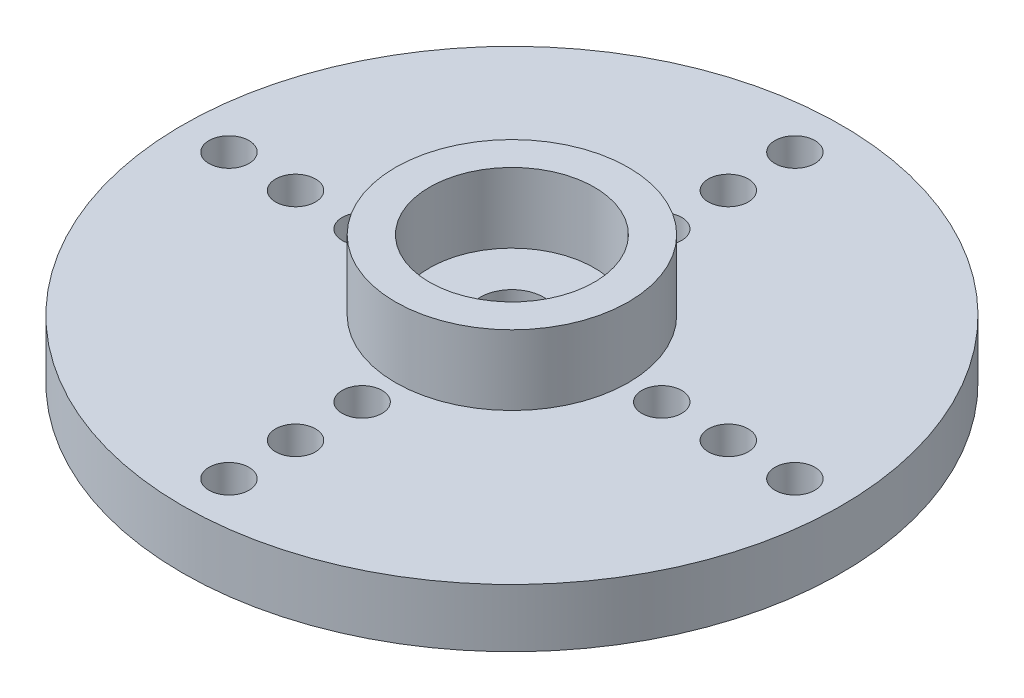
from build123d import *

# Parameters (mm, degrees)
ESQUISSE1_R                  = 9.9
BOSS_EXTRU_1_DEPTH           = 1.75
ESQUISSE2_R                  = 3.5
ESQUISSE2_R_2                = 2.475
BOSS_EXTRU_2_DEPTH           = 2.1
ESQUISSE3_R                  = 2.725
ESQUISSE3_R_2                = 2.225
BOSS_EXTRU_3_DEPTH           = 0.3
ESQUISSE4_R                  = 0.95
ENL_V_MAT_EXTRU_1_DEPTH      = 15.520416661
ESQUISSE5_R                  = 0.6
ENL_V_MAT_EXTRU_2_DEPTH      = 15.520416661
R_P_TITION_CIRCULAIRE1_COUNT = 4


with BuildPart() as part:
    # Esquisse1 → Boss.-Extru.1 (new body)
    with BuildSketch(Plane(origin=(0, 0, 0), x_dir=(1, 0, 0), z_dir=(0, 1, 0))):
        Circle(ESQUISSE1_R)
    extrude(amount=BOSS_EXTRU_1_DEPTH)

    # Esquisse2 → Boss.-Extru.2 (add)
    with BuildSketch(Plane(origin=(0, 1.75, 0), x_dir=(1, 0, 0), z_dir=(0, 1, 0))):
        Circle(ESQUISSE2_R)
        Circle(ESQUISSE2_R_2, mode=Mode.SUBTRACT)
    extrude(amount=BOSS_EXTRU_2_DEPTH)

    # Esquisse3 → Boss.-Extru.3 (add)
    with BuildSketch(Plane.XZ):
        Circle(ESQUISSE3_R)
        Circle(ESQUISSE3_R_2, mode=Mode.SUBTRACT)
    extrude(amount=BOSS_EXTRU_3_DEPTH)

    # Esquisse4 → Enlèv. mat.-Extru.1 (cut, through all)
    with BuildSketch(Plane.XZ):
        Circle(ESQUISSE4_R)
    extrude(amount=-ENL_V_MAT_EXTRU_1_DEPTH, mode=Mode.SUBTRACT)

    # Esquisse5 → Enlèv. mat.-Extru.2 (cut, through all)
    with BuildSketch(Plane.XZ):
        with Locations((0, 4.5)):
            Circle(ESQUISSE5_R)
        with Locations((0, 6.5)):
            Circle(ESQUISSE5_R)
        with Locations((0, 8.5)):
            Circle(ESQUISSE5_R)
    enl_v_mat_extru_2 = extrude(amount=-ENL_V_MAT_EXTRU_2_DEPTH, mode=Mode.SUBTRACT)

    # Répétition circulaire1: Enlèv. mat.-Extru.2 ×4 about axis
    r_p_tition_circulaire1_axis = Axis((0, 1.75, 0), (0, -1, 0))
    for i in range(1, R_P_TITION_CIRCULAIRE1_COUNT):
        add(enl_v_mat_extru_2.rotate(r_p_tition_circulaire1_axis, i * 360 / R_P_TITION_CIRCULAIRE1_COUNT), mode=Mode.SUBTRACT)


solid = part.part
